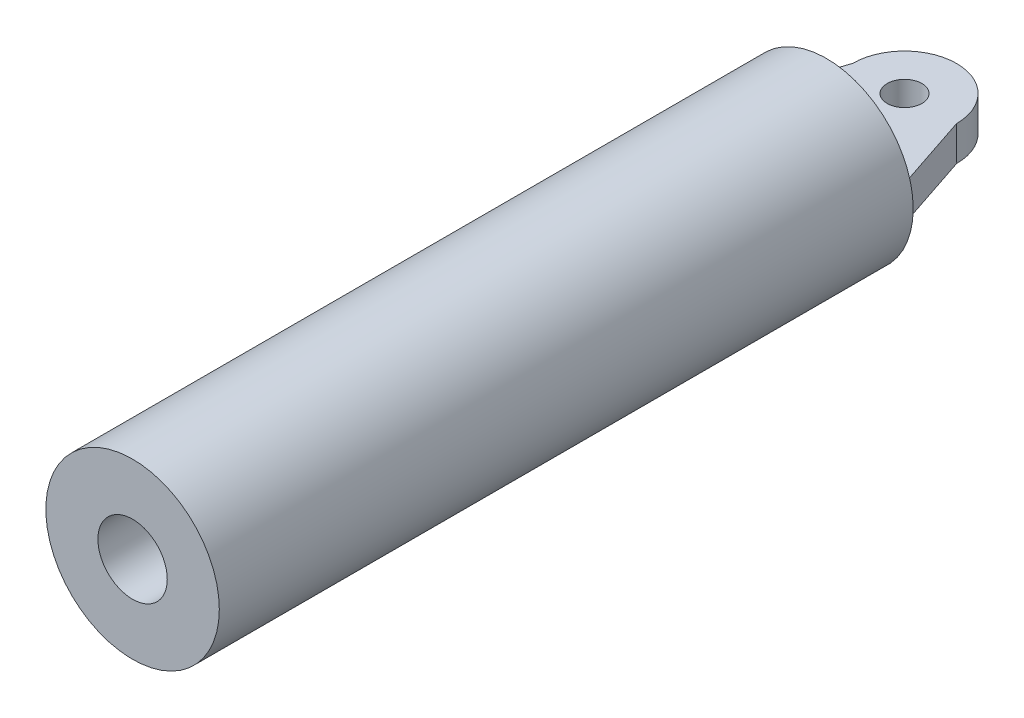
from build123d import *

# Parameters (mm, degrees)
SKETCH1_R           = 50
BOSS_EXTRUDE1_DEPTH = 400
SKETCH3_R           = 10
BOSS_EXTRUDE2_DEPTH = 10
SHELL1_START        = 30
SHELL1_OUTLINE_R    = 20
SHELL1_DEPTH        = 370


# Read off the part's stored shape, not the designer's step: Shell1
with BuildPart() as part:
    # Sketch1 → Boss-Extrude1 (new body)
    with BuildSketch(Plane.XY):
        Circle(SKETCH1_R)
    extrude(amount=BOSS_EXTRUDE1_DEPTH)

    # Sketch3 → Boss-Extrude2 (add, symmetric)
    with BuildSketch(Plane(origin=(0, 0, 0), x_dir=(1, 0, 0), z_dir=(0, 1, 0))):
        with BuildLine():
            ThreePointArc((-30, 45), (0, 75), (30, 45))
            Line((30, 45), (45, 0))
            Line((45, 0), (-45, 0))
            Line((-45, 0), (-30, 45))
        make_face()
        with Locations(Location((0, 45, 0), (0, 0, 270))):
            Circle(SKETCH3_R, mode=Mode.SUBTRACT)
    extrude(amount=BOSS_EXTRUDE2_DEPTH, both=True)

    # Shell1 outline → Shell1 (cut)
    with BuildSketch(Plane.XY.offset(SHELL1_START)):
        Circle(SHELL1_OUTLINE_R)
    extrude(amount=SHELL1_DEPTH, mode=Mode.SUBTRACT)


solid = part.part
